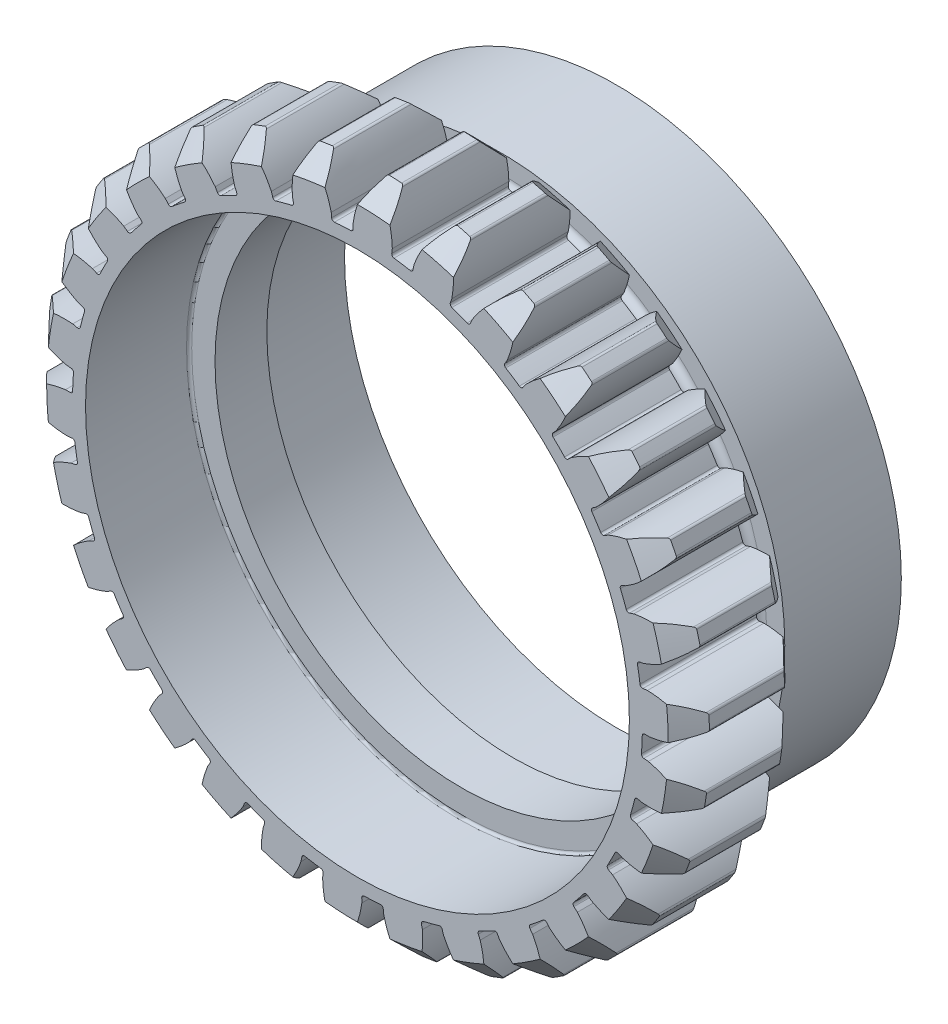
from build123d import *

# Parameters (mm, degrees)
FILLET_1_R                       = 0.3
FILLET_2_R                       = 0.1
EXTRUDE_1_DEPTH                  = 2.25
FILLET_3_R                       = 0.1
PATTERN_CIRCULAR_1_COUNT         = 30
FILLET_3_OF_PATTERN_CIRCULAR_1_R = 0.1


with BuildPart() as part:
    # Эскиз18 → Повернуть1 (revolve)
    with BuildSketch(Plane(origin=(0, 0, 0), x_dir=(0, 0, -1), z_dir=(1, 0, 0))):
        Polygon((-5, -10.5), (-1, -10.5), (-1, -9.5), (1, -9.5), (1, -10.5), (5, -10.5), (5, -11), (0.5, -11), (0.5, -10), (-0.5, -10), (-0.5, -11), (-5, -11), align=None)
    revolve(axis=Axis((0, 0, 0), (0, 0, 1)))

    # Скругление1
    fillet_1_edges = [part.edges().sort_by_distance(p)[0] for p in [
        (0, 10, -0.5),
        (0, 10, 0.5),
    ]]
    fillet(fillet_1_edges, radius=FILLET_1_R)

    # Скругление2
    fillet_2_edges = [part.edges().sort_by_distance(p)[0] for p in [
        (0, 10.5, 1),
        (0, 10.5, -1),
    ]]
    fillet(fillet_2_edges, radius=FILLET_2_R)

    # Эскиз19 → Бобышка-Вытянуть1 (add, symmetric)
    with BuildSketch(Plane.XY.offset(2.75)):
        with BuildLine():
            Line((-0.168060252, 11.275059009), (-0.163942153, 10.998778249))
            ThreePointArc((-0.163942153, 10.998778249), (0.575695519, 10.984924882), (1.312729449, 10.92138917))
            Line((1.312729449, 10.92138917), (1.345704192, 11.195725976))
            add(Edge.make_bspline(
                [(1.345704192, 11.195725976), (1.323252455, 12.019038128), (0.964252067, 12.763628714)],
                knots=[0, 0, 0, 1, 1, 1], degree=2))
            ThreePointArc((0.964252067, 12.763628714), (0.66990024, 12.782458045), (0.375192702, 12.794500007))
            add(Edge.make_bspline(
                [(-0.168060252, 11.275059009), (-0.059671954, 12.091514125), (0.375192702, 12.794500007)],
                knots=[0, 0, 0, 1, 1, 1], degree=2))
        make_face()
    extrude_1 = extrude(amount=EXTRUDE_1_DEPTH, both=True)

    # Скругление3
    fillet_3_edges = [part.edges().sort_by_distance(p)[0] for p in [
        (-0.163942153, 10.998778249, 2.75),
        (1.312729449, 10.92138917, 2.75),
        (0.964252067, 12.763628714, 1.625),
        (0.375192702, 12.794500007, 1.625),
    ]]
    fillet(fillet_3_edges, radius=FILLET_3_R)

    # Круговой массив1: Бобышка-Вытянуть1 ×30 about axis
    pattern_circular_1_axis = Axis((0, 0, 0), (0, 0, -1))
    for i in range(1, PATTERN_CIRCULAR_1_COUNT):
        add(extrude_1.rotate(pattern_circular_1_axis, i * 360 / PATTERN_CIRCULAR_1_COUNT))

    # Скругление3 of Круговой массив1
    fillet_3_of_pattern_circular_1_edges = [part.edges().sort_by_distance(p)[0] for p in [
        (2.126414959, 10.792514045, 2.75),
        (3.554727649, 10.409798814, 2.75),
        (3.596888473, 12.284233526, 1.625),
        (3.027119971, 12.436902536, 1.625),
        (4.323837534, 10.11456519, 2.75),
        (5.641367193, 9.443250298, 2.75),
        (6.072323593, 11.267958386, 1.625),
        (5.546747571, 11.535752744, 1.625),
        (6.33228766, 8.9945613, 2.75),
        (7.481451921, 8.06398643, 2.75),
        (8.282369033, 9.759219395, 1.625),
        (7.823955687, 10.130435204, 1.625),
        (8.06398643, 7.481451921, 2.75),
        (8.9945613, 6.33228766, 2.75),
        (10.130435204, 7.823955687, 1.625),
        (9.759219395, 8.282369033, 1.625),
        (9.443250298, 5.641367193, 2.75),
        (10.11456519, 4.323837534, 2.75),
        (11.535752744, 5.546747571, 1.625),
        (11.267958386, 6.072323593, 1.625),
        (10.409798814, 3.554727649, 2.75),
        (10.792514045, 2.126414959, 2.75),
        (12.436902536, 3.027119971, 1.625),
        (12.284233526, 3.596888473, 1.625),
        (10.92138917, 1.312729449, 2.75),
        (10.998778249, -0.163942153, 2.75),
        (12.794500007, 0.375192702, 1.625),
        (12.763628714, 0.964252067, 1.625),
        (10.955662412, -0.986641328, 2.75),
        (10.724343065, -2.447134206, 2.75),
        (12.592916434, -2.293132289, 1.625),
        (12.685192081, -1.710526781, 1.625),
        (10.511120636, -3.242891144, 2.75),
        (9.981202628, -4.623374752, 2.75),
        (11.840961985, -4.861236394, 1.625),
        (12.052351684, -4.310547401, 1.625),
        (9.607192451, -5.357411056, 2.75),
        (8.801835741, -6.597551636, 2.75),
        (10.571500677, -7.216881143, 1.625),
        (10.892765684, -6.722176415, 1.625),
        (8.283383854, -7.237786397, 2.75),
        (7.237786397, -8.283383854, 2.75),
        (8.840014063, -9.257113555, 1.625),
        (9.257113555, -8.840014063, 1.625),
        (6.597551636, -8.801835741, 2.75),
        (5.357411056, -9.607192451, 2.75),
        (6.722176415, -10.892765684, 1.625),
        (7.216881143, -10.571500677, 1.625),
        (4.623374752, -9.981202628, 2.75),
        (3.242891144, -10.511120636, 2.75),
        (4.310547401, -12.052351684, 1.625),
        (4.861236394, -11.840961985, 1.625),
        (2.447134206, -10.724343065, 2.75),
        (0.986641328, -10.955662412, 2.75),
        (1.710526781, -12.685192081, 1.625),
        (2.293132289, -12.592916434, 1.625),
        (0.163942153, -10.998778249, 2.75),
        (-1.312729449, -10.92138917, 2.75),
        (-0.964252067, -12.763628714, 1.625),
        (-0.375192702, -12.794500007, 1.625),
        (-2.126414959, -10.792514045, 2.75),
        (-3.554727649, -10.409798814, 2.75),
        (-3.596888473, -12.284233526, 1.625),
        (-3.027119971, -12.436902536, 1.625),
        (-4.323837534, -10.11456519, 2.75),
        (-5.641367193, -9.443250298, 2.75),
        (-6.072323593, -11.267958386, 1.625),
        (-5.546747571, -11.535752744, 1.625),
        (-6.33228766, -8.9945613, 2.75),
        (-7.481451921, -8.06398643, 2.75),
        (-8.282369033, -9.759219395, 1.625),
        (-7.823955687, -10.130435204, 1.625),
        (-8.06398643, -7.481451921, 2.75),
        (-8.9945613, -6.33228766, 2.75),
        (-10.130435204, -7.823955687, 1.625),
        (-9.759219395, -8.282369033, 1.625),
        (-9.443250298, -5.641367193, 2.75),
        (-10.11456519, -4.323837534, 2.75),
        (-11.535752744, -5.546747571, 1.625),
        (-11.267958386, -6.072323593, 1.625),
        (-10.409798814, -3.554727649, 2.75),
        (-10.792514045, -2.126414959, 2.75),
        (-12.436902536, -3.027119971, 1.625),
        (-12.284233526, -3.596888473, 1.625),
        (-10.92138917, -1.312729449, 2.75),
        (-10.998778249, 0.163942153, 2.75),
        (-12.794500007, -0.375192702, 1.625),
        (-12.763628714, -0.964252067, 1.625),
        (-10.955662412, 0.986641328, 2.75),
        (-10.724343065, 2.447134206, 2.75),
        (-12.592916434, 2.293132289, 1.625),
        (-12.685192081, 1.710526781, 1.625),
        (-10.511120636, 3.242891144, 2.75),
        (-9.981202628, 4.623374752, 2.75),
        (-11.840961985, 4.861236394, 1.625),
        (-12.052351684, 4.310547401, 1.625),
        (-9.607192451, 5.357411056, 2.75),
        (-8.801835741, 6.597551636, 2.75),
        (-10.571500677, 7.216881143, 1.625),
        (-10.892765684, 6.722176415, 1.625),
        (-8.283383854, 7.237786397, 2.75),
        (-7.237786397, 8.283383854, 2.75),
        (-8.840014063, 9.257113555, 1.625),
        (-9.257113555, 8.840014063, 1.625),
        (-6.597551636, 8.801835741, 2.75),
        (-5.357411056, 9.607192451, 2.75),
        (-6.722176415, 10.892765684, 1.625),
        (-7.216881143, 10.571500677, 1.625),
        (-4.623374752, 9.981202628, 2.75),
        (-3.242891144, 10.511120636, 2.75),
        (-4.310547401, 12.052351684, 1.625),
        (-4.861236394, 11.840961985, 1.625),
        (-2.447134206, 10.724343065, 2.75),
        (-0.986641328, 10.955662412, 2.75),
        (-1.710526781, 12.685192081, 1.625),
        (-2.293132289, 12.592916434, 1.625),
    ]]
    fillet(fillet_3_of_pattern_circular_1_edges, radius=FILLET_3_OF_PATTERN_CIRCULAR_1_R)

    # Эскиз21 → Вырез-Повернуть1 (revolve, cut)
    with BuildSketch(Plane(origin=(0, 0, 0), x_dir=(0, 0, -1), z_dir=(1, 0, 0))):
        Polygon((-5, 12), (-5, 12.8), (-4.2, 12.8), align=None)
        Polygon((-0.5, 12.8), (-1.3, 12.8), (-0.5, 12), align=None)
    revolve(axis=Axis((0, 0, 0), (0, 0, -1)), mode=Mode.SUBTRACT)


solid = part.part
